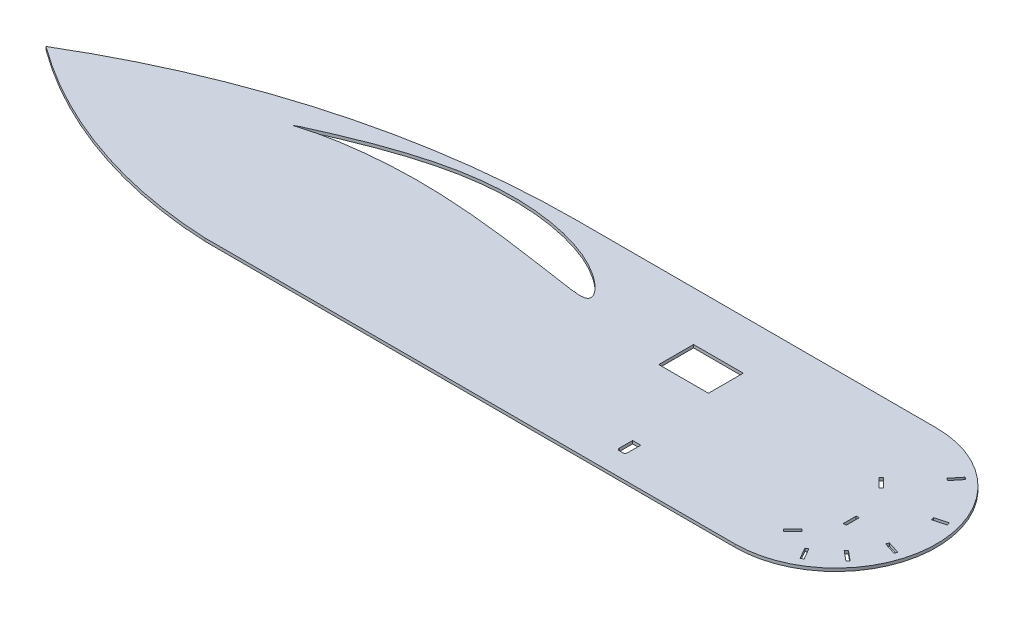
from build123d import *

# Parameters (mm, degrees)
BOSS_EXTRUDE1_DEPTH = 3
SKETCH2_W           = 50
SKETCH2_H           = 35
SKETCH2_W_2         = 3
SKETCH2_H_2         = 13
CUT_EXTRUDE1_DEPTH  = 924.723412329


with BuildPart() as part:
    # Sketch1 → Boss-Extrude1 (new body)
    with BuildSketch(Plane(origin=(0, 0, 0), x_dir=(1, 0, 0), z_dir=(0, 1, 0))):
        with BuildLine():
            Line((266.408252791, 0), (800, 0))
            ThreePointArc((800, 0), (901.249284204, 101.249284204), (800, 202.498568407))
            Line((800, 202.498568407), (438.319179988, 202.498568407))
            ThreePointArc((438.319179988, 202.498568407), (221.044276809, 173.066910271), (19.429068043, 86.893169221))
            ThreePointArc((19.429068043, 86.893169221), (136.475600537, 25.133273094), (266.408252791, 0))
        make_face()
    extrude(amount=BOSS_EXTRUDE1_DEPTH)

    # Sketch2 → Cut-Extrude1 (cut, through all)
    with BuildSketch(Plane.XZ):
        with Locations((630.07, -135.5)):
            Rectangle(SKETCH2_W, SKETCH2_H)
        Polygon((823.689305431, -121.232773416), (814.496917276, -130.425161571), (816.618237619, -132.546481915), (825.810625775, -123.354093759), align=None)
        Polygon((841.197249001, -32.961563396), (847.702049467, -21.706006062), (845.104613159, -20.204898262), (838.599812693, -31.460455596), align=None)
        with Locations((837.956551938, -78.816857662)):
            Rectangle(SKETCH2_W_2, SKETCH2_H_2)
        with BuildLine():
            Line((212.57, -142.261782597), (212.57, -142.294782597))
            add(Edge.make_bspline(
                [(212.57, -142.294782597), (212.815137814, -142.460102486), (213.721483955, -143.071338431), (215.664179604, -144.220627165), (218.723437449, -145.777902142), (222.783765044, -147.580430449), (227.75908382, -149.780753256), (233.673151887, -152.372942719), (243.334631626, -156.473964415), (254.071597155, -160.928560196), (265.811315632, -165.551386352), (275.559769605, -169.192616013), (285.820264156, -172.789650289), (300.213165162, -177.442893994), (315.047470761, -181.61442891), (330.216772764, -185.078244178), (341.716798025, -187.262793988), (353.238408154, -188.970546018), (364.74982071, -190.189827969), (376.222154657, -190.889317525), (387.611451467, -191.086885836), (398.853751386, -190.764655348), (413.421420996, -189.696341642), (427.580802498, -187.700042396), (441.195366572, -184.827458978), (450.821943115, -182.319735681), (459.948918056, -179.469695278), (468.511745548, -176.287644359), (476.453624938, -172.824739179), (483.715148146, -169.128859345), (490.24814377, -165.284833696), (496.019667562, -161.40694583), (500.998027396, -157.585747413), (505.147593549, -153.884087589), (508.447339472, -150.382728864), (510.852240131, -147.180842115), (512.23052565, -144.518995071), (512.672376723, -142.438033672), (512.365957104, -140.693980261), (510.836297954, -139.267947677), (508.300825673, -138.604557497), (504.990749494, -138.396901122), (500.845143819, -138.632879923), (495.886387834, -139.207005807), (490.127383335, -140.033765729), (483.600688534, -141.01415409), (476.345974836, -142.081971784), (468.41886468, -143.270863791), (459.86962452, -144.552957933), (447.40415706, -146.414008038), (434.302787697, -148.29198326), (413.230560269, -151.080307043), (394.916461571, -153.170522792), (372.413070638, -155.185169178), (353.278576878, -156.497400442), (334.10390548, -157.12050793), (318.83753012, -157.119300437), (307.569298967, -156.863067348), (296.54483902, -156.342386113), (285.853643217, -155.59861473), (275.586288909, -154.654588864), (265.829573747, -153.556930461), (256.673464041, -152.312824912), (248.205041684, -150.95854436), (240.510067524, -149.523302558), (233.666056009, -148.064077742), (227.735558734, -146.629571507), (222.771530443, -145.20558608), (218.774640723, -143.912633605), (215.724793866, -142.995242016), (213.753356987, -142.496728121), (212.816237246, -142.310670921), (212.57, -142.261782597)],
                knots=[0, 0, 0, 0, 0.001413477, 0.005226038, 0.010781091, 0.017815608, 0.026460951, 0.036790889, 0.048685593, 0.076639155, 0.092362872, 0.109003461, 0.126386903, 0.144339126, 0.181312719, 0.200023431, 0.218712626, 0.237261299, 0.255692478, 0.274037197, 0.292192583, 0.310132767, 0.327788163, 0.362001934, 0.378421226, 0.394286639, 0.40954344, 0.424114253, 0.43793778, 0.450941833, 0.463044023, 0.474154417, 0.484164575, 0.493023962, 0.500713088, 0.507125739, 0.512129705, 0.514904185, 0.517171427, 0.520261618, 0.5242453, 0.529497961, 0.536092185, 0.54406114, 0.553363127, 0.563904543, 0.575614949, 0.588420092, 0.60222661, 0.616944448, 0.648675826, 0.665501113, 0.718564132, 0.736789145, 0.773513212, 0.810244924, 0.828488569, 0.846493195, 0.864125178, 0.88124851, 0.897725282, 0.913415058, 0.928184346, 0.941897285, 0.954411455, 0.965602702, 0.975349728, 0.983575522, 0.990284579, 0.99543259, 0.998799869, 1, 1, 1, 1], degree=3))
        make_face()
        with BuildLine():
            Line((658.07, -25.47338103), (658.07, -38.67338103))
            Line((658.07, -38.67338103), (666.27, -38.67338103))
            Line((666.27, -38.67338103), (666.27, -25.47338103))
            ThreePointArc((666.27, -25.47338103), (665.537766953, -23.705614077), (663.77, -22.97338103))
            Line((663.77, -22.97338103), (660.57, -22.97338103))
            ThreePointArc((660.57, -22.97338103), (658.802233047, -23.705614077), (658.07, -25.47338103))
        make_face()
        Polygon((849.214584329, -164.005565384), (857.427776257, -174.082443788), (859.753209734, -172.187091805), (851.540017807, -162.110213401), align=None)
        Polygon((876.759798116, -122.890899938), (889.336145671, -126.182629298), (890.095775523, -123.280395247), (877.519427968, -119.988665887), align=None)
        Polygon((876.494039563, -78.686304576), (888.891550999, -74.774564529), (887.988841757, -71.913600351), (875.591330321, -75.825340399), align=None)
        Polygon((862.379211556, -51.557633959), (872.393174091, -43.267847813), (870.480146518, -40.956933382), (860.466183984, -49.246719528), align=None)
        Polygon((822.408918341, -44.734564453), (813.216530186, -35.542176297), (811.095209842, -37.663496641), (820.287597998, -46.855884796), align=None)
    extrude(amount=-CUT_EXTRUDE1_DEPTH, mode=Mode.SUBTRACT)


solid = part.part
